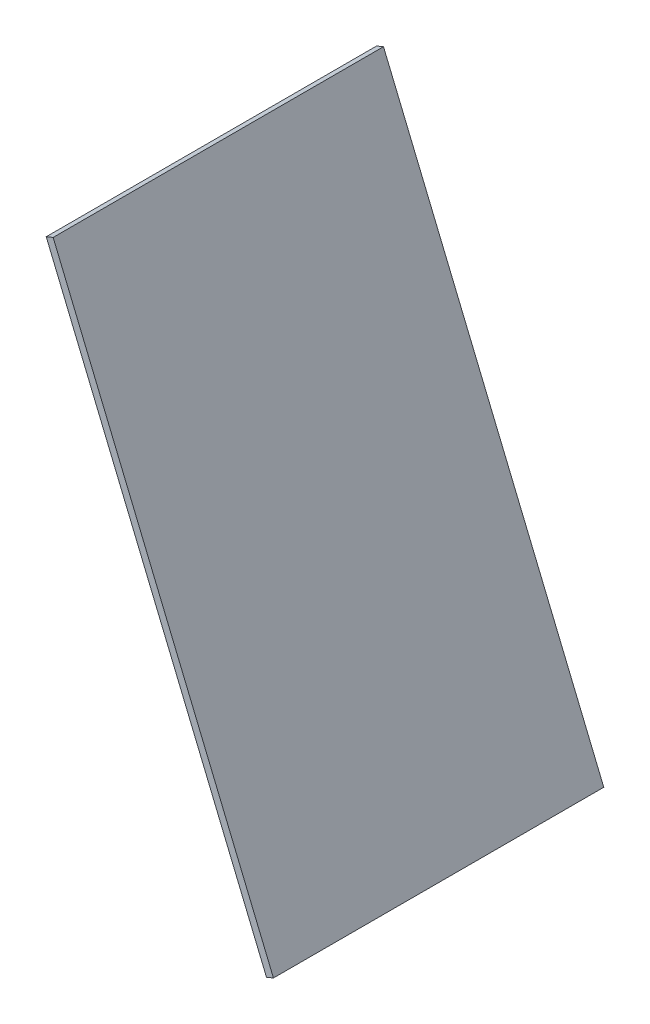
from build123d import *

# Parameters (mm, degrees)
SKETCH1_W           = 139.7
SKETCH1_H           = 243.2
BOSS_EXTRUDE1_DEPTH = 3.175


with BuildPart() as part:
    # Sketch1 → Boss-Extrude1 (new body)
    with BuildSketch(Plane(origin=(-144.366987294, -59.865707223, 0), x_dir=(0, 0, 1), z_dir=(-0.9237280213470658, -0.38304900806324355, 0))):
        with Locations((4.397002221, -177.378984445)):
            Rectangle(SKETCH1_W, SKETCH1_H)
    extrude(amount=BOSS_EXTRUDE1_DEPTH)


solid = part.part
